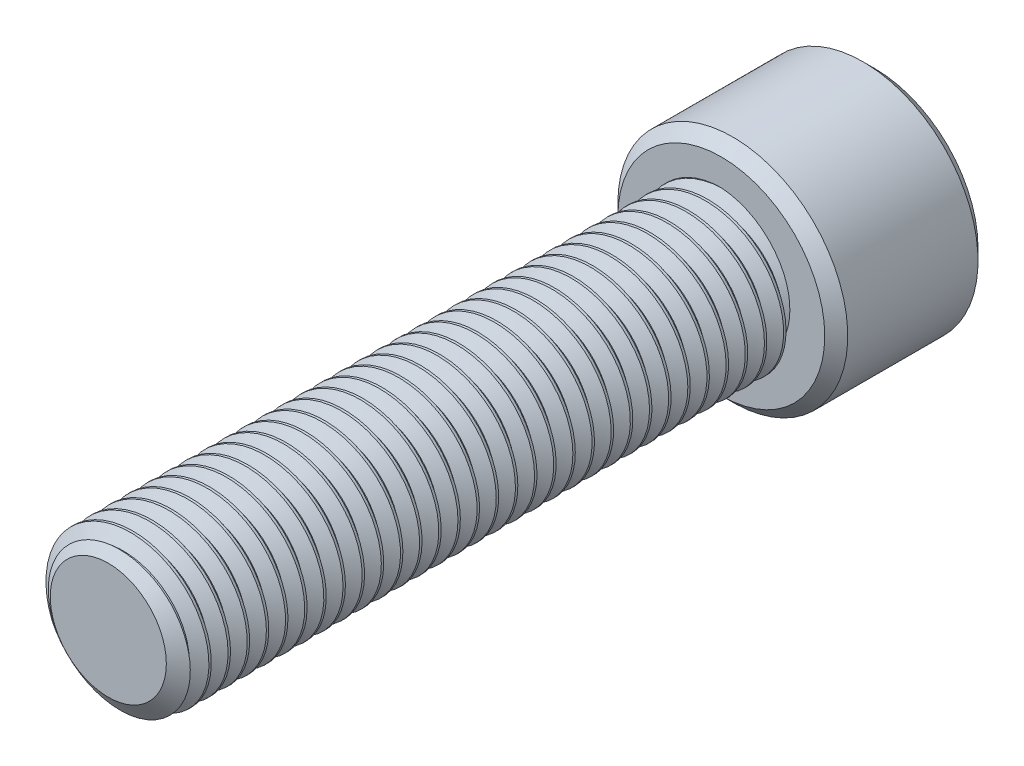
from build123d import *

# Parameters (mm, degrees)
SKETCH1_R          = 3.175
EXTRUDE1_DEPTH     = 25.4
CUT_SWEEP1_PITCH   = 0.79375
SKETCH6_R          = 4.7625
EXTRUDE2_DEPTH     = 6.35
CUT_EXTRUDE1_DEPTH = 3.571875
CHAMFER1_SIZE      = 0.47625


with BuildPart() as part:
    # Sketch1 → Extrude1 (new body)
    with BuildSketch(Plane.XY):
        Circle(SKETCH1_R)
    extrude(amount=-EXTRUDE1_DEPTH)

    # Cut-Sweep1: arcs per turn and ends read off the stored shape
    # Cut-Sweep1: the profile of Sketch3 profile screwed along a right-hand helix through 35 turns, 6 arcs to a turn; built about Z, then put on its axis
    cut_sweep1_z = Axis((0, 0, 0), (0, 0, 1))
    cut_sweep1_corners = [(3.1753, 0, -1.488454455), (2.659444252, 0, -1.190625), (2.659444252, 0, -1.09140625), (3.1753, 0, -0.793576795)]
    with BuildLine(mode=Mode.PRIVATE) as cut_sweep1_profile:
        Line(cut_sweep1_corners[0], cut_sweep1_corners[1])
        Line(cut_sweep1_corners[1], cut_sweep1_corners[2])
        Line(cut_sweep1_corners[2], cut_sweep1_corners[3])
        Line(cut_sweep1_corners[3], cut_sweep1_corners[0])
    cut_sweep1_cap = Face(cut_sweep1_profile.wire())
    cut_sweep1_turn_angles = [0, 30, 60, 90, 120, 150, 180, 210, 240, 270, 300, 330, 360]
    cut_sweep1_turn_weights = [1, 0.8660254037844387, 1, 0.8660254037844387, 1, 0.8660254037844387, 1, 0.8660254037844387, 1, 0.8660254037844387, 1, 0.8660254037844387, 1]
    cut_sweep1_turn_rails = [Edge.make_bspline([Vector(p[0], p[1], 0).rotate(cut_sweep1_z, cut_sweep1_turn_angles[k]) / cut_sweep1_turn_weights[k] + Vector(0, 0, p[2] + CUT_SWEEP1_PITCH * cut_sweep1_turn_angles[k] / 360) for k in range(13)], [0, 0, 0, 1, 1, 2, 2, 3, 3, 4, 4, 5, 5, 6, 6, 6], 2, cut_sweep1_turn_weights) for p in cut_sweep1_corners]
    cut_sweep1_turn_sides = [Face.make_surface_from_curves(cut_sweep1_turn_rails[p[0]], cut_sweep1_turn_rails[p[1]]) for p in [(0, 1), (1, 2), (2, 3), (3, 0)]]
    cut_sweep1 = Plane(origin=(0, 0, 0), x_dir=(0, 1, 0), z_dir=(0, 0, -1)) * Solid(Shell([*[p.moved(Location((0, 0, CUT_SWEEP1_PITCH * i))) for i in range(35) for p in cut_sweep1_turn_sides], cut_sweep1_cap, cut_sweep1_cap.rotate(cut_sweep1_z, 12600).moved(Location((0, 0, CUT_SWEEP1_PITCH * 12600 / 360)))]))
    add(cut_sweep1, mode=Mode.SUBTRACT)

    # Sketch4 → Cut-Revolve1 (revolve, cut)
    with BuildSketch(Plane(origin=(0, 0, 0), x_dir=(0, 0, -1), z_dir=(1, 0, 0)), mode=Mode.PRIVATE) as cut_revolve1_sk:
        Polygon((0.538848736, 3.175), (0, 2.405444252), (0, 3.175), align=None)
    revolve(cut_revolve1_sk.sketch.rotate(Axis((0, 0, 0), (0, 0, -1)), 261.048315518), axis=Axis((0, 0, 0), (0, 0, -1)), mode=Mode.SUBTRACT)

    # Sketch6 → Extrude2 (add)
    with BuildSketch(Plane(origin=(0, 0, -25.4), x_dir=(-1, 0, 0), z_dir=(0, 0, -1))):
        Circle(SKETCH6_R)
    extrude(amount=EXTRUDE2_DEPTH)

    # Sketch7 → Cut-Extrude1 (cut)
    with BuildSketch(Plane(origin=(0, 0, -31.75), x_dir=(-1, 0, 0), z_dir=(0, 0, -1))):
        Polygon((0, 2.749630657), (-2.38125, 1.374815329), (-2.38125, -1.374815329), (0, -2.749630657), (2.38125, -1.374815329), (2.38125, 1.374815329), align=None)
    extrude(amount=-CUT_EXTRUDE1_DEPTH, mode=Mode.SUBTRACT)

    # Cut-Extrude2 cone 1 section (through the dimple's axis) → Cut-Extrude2 (revolve, cut)
    with BuildSketch(Plane(origin=(0, 0, -31.75), x_dir=(0, 1, 0), z_dir=(1, 0, 0))):
        Polygon((0, 0), (2.749630657, 0), (0, 2.749630657), align=None)
    revolve(axis=Axis((0, 0, -31.75), (0, 0, 1)), mode=Mode.SUBTRACT)

    # Chamfer1
    chamfer1_edges = [part.edges().sort_by_distance(p)[0] for p in [
        (4.7625, 0, -25.4),
        (4.7625, 0, -31.75),
    ]]
    chamfer(chamfer1_edges, length=CHAMFER1_SIZE)


solid = part.part
